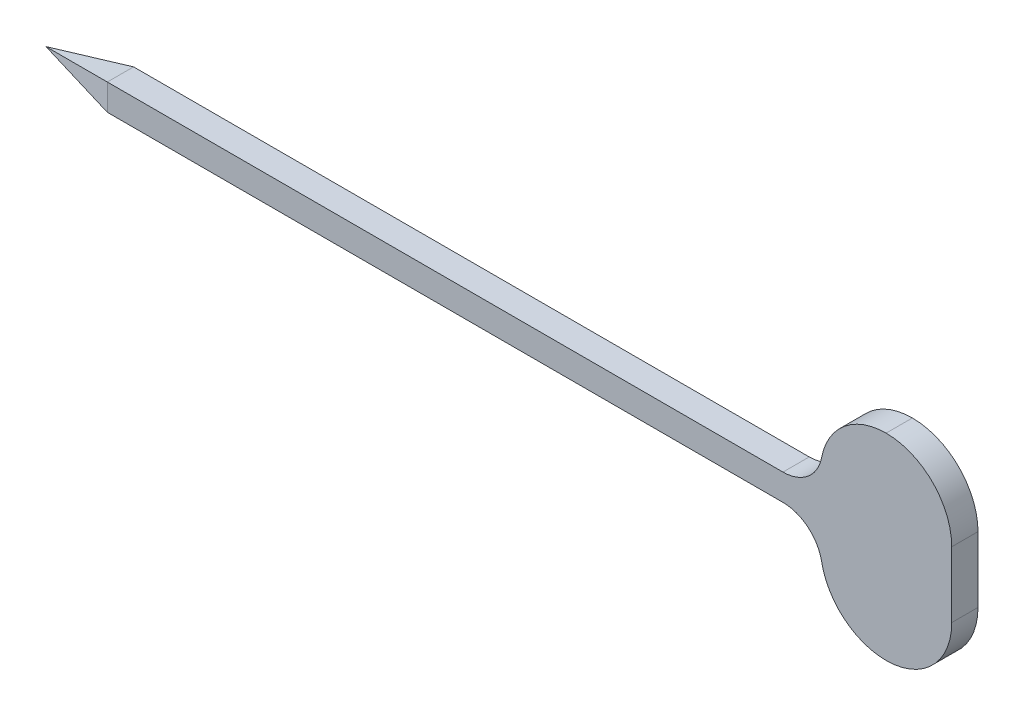
from build123d import *

# Parameters (mm, degrees)
SKETCH1_W           = 60
SKETCH1_H           = 2
BOSS_EXTRUDE1_DEPTH = 2
CHAMFER1_SIZE       = 5.67128182
CHAMFER1_SIZE_2     = 1
FILLET1_R           = 5
FILLET2_R           = 3


# Some blends are built 0.0001 mm under size
with BuildPart() as part:
    # Sketch1 → Boss-Extrude1 (new body)
    with BuildSketch(Plane.XY):
        Rectangle(SKETCH1_W, SKETCH1_H)
        Polygon((30, 1), (30, -1), (30, -7.5), (40, -7.5), (40, 7.5), (30, 7.5), align=None)
    extrude(amount=BOSS_EXTRUDE1_DEPTH)

    # Chamfer1
    # the kernel refuses this chamfer: 5.67128182, 1 mm, written as the material it takes off along each edge
    with BuildSketch(Plane(origin=(-30, -15.737045834, 0), x_dir=(0.9999776716360547, 0, -0.006682531656101592), z_dir=(0, 1, 0)), Plane(origin=(-30, 1, -14.737045834), x_dir=(0.9999776716360547, 0.00668253165610172, 0), z_dir=(0, 0, 1))) as chamfer1_piece_1:
        Polygon((CHAMFER1_SIZE * 0.999977671569, -CHAMFER1_SIZE * 0.00668253165565), (-CHAMFER1_SIZE_2 * 0.00668253165611, -CHAMFER1_SIZE_2 * 0.999977671636), (0, 0), align=None)
    extrude(amount=31.474091667, mode=Mode.SUBTRACT)
    with BuildSketch(Plane(origin=(-30, -1, -14.737045834), x_dir=(-0.21013876076743543, 0.9776715712462578, 0), z_dir=(0, 0, 1))) as chamfer1_piece_2:
        Polygon((CHAMFER1_SIZE_2 * 0.977671571246, -CHAMFER1_SIZE_2 * 0.210138760767), (-CHAMFER1_SIZE * 0.210138760753, -CHAMFER1_SIZE * 0.97767157118), (0, 0), align=None)
    extrude(amount=31.474091667, mode=Mode.SUBTRACT)
    with BuildSketch(Plane(origin=(-30, -15.737045834, 2), x_dir=(0.9999776716360547, 0, 0.006682531656101588), z_dir=(0, 1, 0))) as chamfer1_piece_3:
        Polygon((CHAMFER1_SIZE * 0.999977671569, CHAMFER1_SIZE * 0.00668253165565), (-CHAMFER1_SIZE_2 * 0.00668253165611, CHAMFER1_SIZE_2 * 0.999977671636), (0, 0), align=None)
    extrude(amount=31.474091667, mode=Mode.SUBTRACT)

    # Fillet1
    fillet1_edges = [part.edges().sort_by_distance(p)[0] for p in [
        (40, -7.5, 1),
        (40, 7.5, 1),
        (30, 7.5, 1),
        (30, -7.5, 1),
    ]]
    fillet(fillet1_edges, radius=FILLET1_R - 0.0001)  # a hair under: the kernel refuses the full size

    # Fillet2
    fillet2_edges = [part.edges().sort_by_distance(p)[0] for p in [
        (30, 1, 1),
        (30, -1, 1),
    ]]
    fillet(fillet2_edges, radius=FILLET2_R)


solid = part.part
